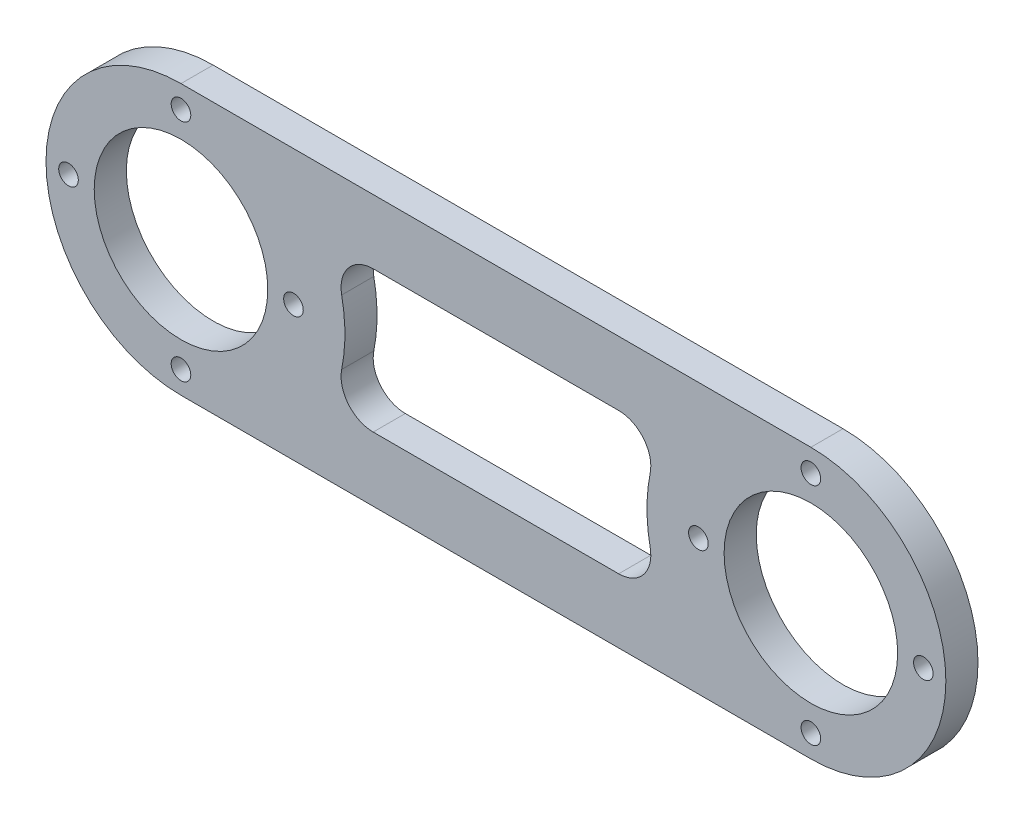
from build123d import *

# Parameters (mm, degrees)
SKETCH1_R           = 13
SKETCH1_R_2         = 1.5
BOSS_EXTRUDE1_DEPTH = 5
SKETCH2_R           = 13.5
CUT_EXTRUDE1_DEPTH  = 10
CUT_EXTRUDE2_DEPTH  = 10
FILLET1_R           = 5
SKETCH4_R           = 1.525
CUT_EXTRUDE3_DEPTH  = 10


with BuildPart() as part:
    # Sketch1 → Boss-Extrude1 (new body)
    with BuildSketch(Plane.XY):
        with BuildLine():
            Line((49, 26), (-49, 26))
            ThreePointArc((-49, 26), (-70, 5), (-49, -16))
            Line((-49, -16), (49, -16))
            ThreePointArc((49, -16), (70, 5), (49, 26))
        make_face()
        with Locations((-49, 5)):
            Circle(SKETCH1_R, mode=Mode.SUBTRACT)
        with Locations((-66.5, 5)):
            Circle(SKETCH1_R_2, mode=Mode.SUBTRACT)
        with Locations((-49, 22.5)):
            Circle(SKETCH1_R_2, mode=Mode.SUBTRACT)
        with Locations((-31.5, 5)):
            Circle(SKETCH1_R_2, mode=Mode.SUBTRACT)
        with Locations((-49, -12.5)):
            Circle(SKETCH1_R_2, mode=Mode.SUBTRACT)
        with Locations((49, 5)):
            Circle(SKETCH1_R, mode=Mode.SUBTRACT)
        with Locations((31.5, 5)):
            Circle(SKETCH1_R_2, mode=Mode.SUBTRACT)
        with Locations((49, 22.5)):
            Circle(SKETCH1_R_2, mode=Mode.SUBTRACT)
        with Locations((66.5, 5)):
            Circle(SKETCH1_R_2, mode=Mode.SUBTRACT)
        with Locations((49, -12.5)):
            Circle(SKETCH1_R_2, mode=Mode.SUBTRACT)
    extrude(amount=BOSS_EXTRUDE1_DEPTH)

    # Sketch2 → Cut-Extrude1 (cut)
    with BuildSketch(Plane(origin=(0, 0, 0), x_dir=(-1, 0, 0), z_dir=(0, 0, -1))):
        with Locations((-49, 5)):
            Circle(SKETCH2_R)
        with Locations((49, 5)):
            Circle(SKETCH2_R)
    extrude(amount=-CUT_EXTRUDE1_DEPTH, mode=Mode.SUBTRACT)

    # Sketch3 → Cut-Extrude2 (cut)
    with BuildSketch(Plane.XY.offset(5)):
        with BuildLine():
            Line((-25.994565859, 16), (25.994565859, 16))
            ThreePointArc((25.994565859, 16), (23.5, 5), (25.994565859, -6))
            Line((25.994565859, -6), (-25.994565859, -6))
            ThreePointArc((-25.994565859, -6), (-23.5, 5), (-25.994565859, 16))
        make_face()
    extrude(amount=-CUT_EXTRUDE2_DEPTH, mode=Mode.SUBTRACT)

    # Fillet1
    fillet1_edges = [part.edges().sort_by_distance(p)[0] for p in [
        (25.994565859, -6, 2.5),
        (-25.994565859, -6, 2.5),
        (25.994565859, 16, 2.5),
        (-25.994565859, 16, 2.5),
    ]]
    fillet(fillet1_edges, radius=FILLET1_R)

    # Sketch4 → Cut-Extrude3 (cut)
    with BuildSketch(Plane.XY.offset(5)):
        with Locations((-49, 22.5)):
            Circle(SKETCH4_R)
        with Locations((-66.5, 5)):
            Circle(SKETCH4_R)
        with Locations((-31.5, 5)):
            Circle(SKETCH4_R)
        with Locations((-49, -12.5)):
            Circle(SKETCH4_R)
        with Locations((49, 22.5)):
            Circle(SKETCH4_R)
        with Locations((31.5, 5)):
            Circle(SKETCH4_R)
        with Locations((66.5, 5)):
            Circle(SKETCH4_R)
        with Locations((49, -12.5)):
            Circle(SKETCH4_R)
    extrude(amount=-CUT_EXTRUDE3_DEPTH, mode=Mode.SUBTRACT)


solid = part.part
